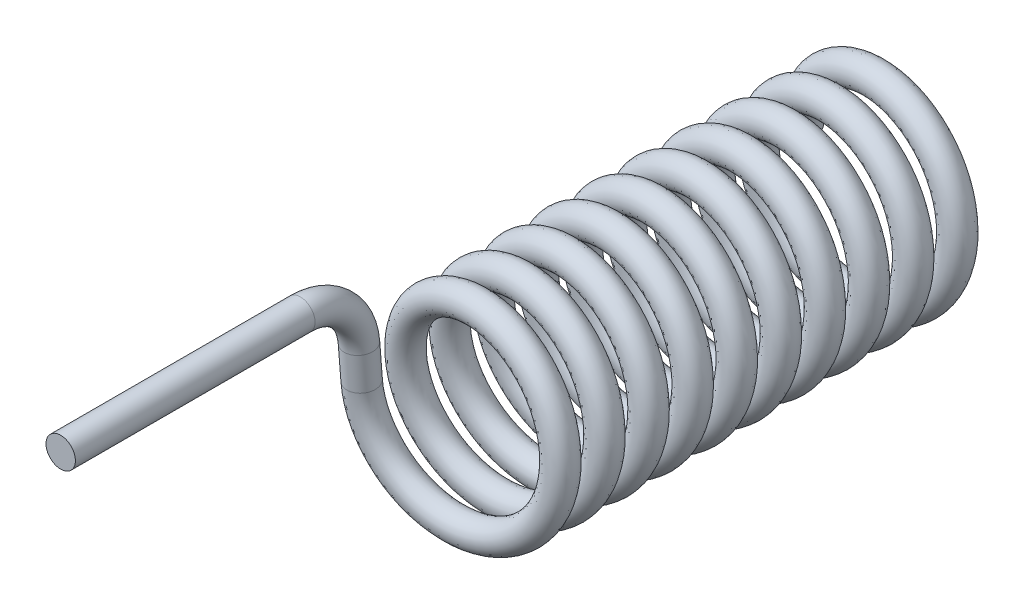
from build123d import *

# Parameters (mm, degrees)
SWEEP1_PITCH       = 1.5
SWEEP1_HEIGHT      = 15
SWEEP1_RADIUS      = 3
SWEEP1_START_ANGLE = -180
SWEEP1_PROFILE_R   = 0.5
SWEEP2_OUTLINE_R   = 0.5
SWEEP2_ANGLE       = 85.496725
SWEEP2_START       = 1.177334544
SWEEP2_2_OUTLINE_R = 0.5
SWEEP2_2_DEPTH     = 1.161021934
SWEEP2_START_2     = 17.084952549
SWEEP2_3_OUTLINE_R = 0.5
SWEEP2_3_DEPTH     = 8.15132512


with BuildPart() as part:
    # Sweep1: sweep along a helix
    with BuildLine() as sweep1_path:
        add(Helix(SWEEP1_PITCH, SWEEP1_HEIGHT, SWEEP1_RADIUS, center=(0, 0, 0), direction=(0, 0, 1), lefthand=True, mode=Mode.PRIVATE).rotate(Axis((0, 0, 0), (0, 0, 1)), SWEEP1_START_ANGLE))
    # Sweep1 profile (on start of the path) → Sweep1 (sweep)
    with BuildSketch(Plane(origin=(-3, 0, 0), x_dir=(0, -0.07932669684369839, 0.996848672150326), z_dir=(2.584913037206128e-13, 0.996848672150326, 0.07932669684369839))):
        Circle(SWEEP1_PROFILE_R)
    sweep(path=sweep1_path.line, is_frenet=True)



with BuildPart() as body_2:
    # Sweep2: read off the stored shape, not the designer's step
    # Sweep2 outline → Sweep2 (revolve)
    with BuildSketch(Plane(origin=(0, 1, 17.084952649), x_dir=(0, 0.07851608129461835, -0.9969128472329649), z_dir=(0, -0.9969128472329649, -0.07851608129461835))):
        with Locations((2, -3)):
            Circle(SWEEP2_OUTLINE_R)
    revolve(axis=Axis((0, 1, 17.084952649), (1, 0, 0)), revolution_arc=SWEEP2_ANGLE)


with BuildPart() as part_1:
    add(part.part)

    add(body_2.part)  # Sweep2 2 merges body 2
    # Sweep2 2 outline → Sweep2 2 (add)
    with BuildSketch(Plane(origin=(0, 0, 0), x_dir=(1, 0, 0), z_dir=(0, 0.9969128472329641, 0.07851608129462931)).offset(SWEEP2_START)):
        with Locations((-3, -14.953692708)):
            Circle(SWEEP2_2_OUTLINE_R)
    extrude(amount=SWEEP2_2_DEPTH)

    # Sweep2 3 outline → Sweep2 3 (add)
    with BuildSketch(Plane.XY.offset(SWEEP2_START_2)):
        with Locations((-3, 3)):
            Circle(SWEEP2_3_OUTLINE_R)
    extrude(amount=SWEEP2_3_DEPTH)


solid = part_1.part
